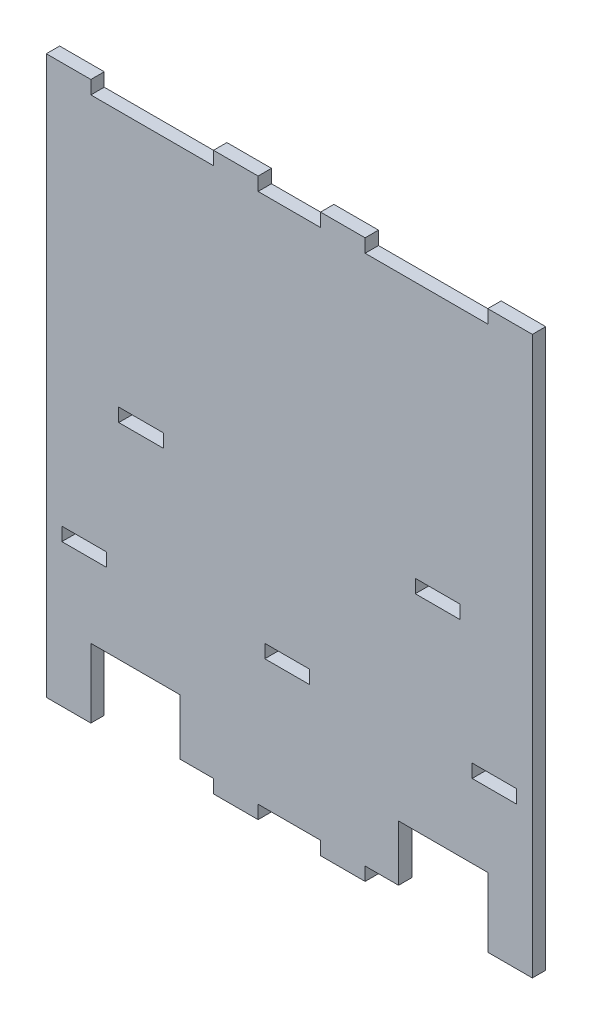
from build123d import *

# Parameters (mm, degrees)
ESQUISSE1_W             = 218
ESQUISSE1_H             = 238
ESQUISSE1_W_2           = 20
ESQUISSE1_H_2           = 6
BOSS_EXTRU_1_DEPTH      = 6
ESQUISSE2_W             = 40
ESQUISSE2_H             = 25
ENL_V_MAT_EXTRU_1_DEPTH = 6
ESQUISSE3_W             = 20
ESQUISSE3_H             = 6
BOSS_EXTRU_3_DEPTH      = 6


with BuildPart() as part:
    # Esquisse1 → Boss.-Extru.1 (new body)
    with BuildSketch(Plane.XY):
        Rectangle(ESQUISSE1_W, ESQUISSE1_H)
        with Locations((-92, -58)):
            Rectangle(ESQUISSE1_W_2, ESQUISSE1_H_2, mode=Mode.SUBTRACT)
        with Locations((-1, -58)):
            Rectangle(ESQUISSE1_W_2, ESQUISSE1_H_2, mode=Mode.SUBTRACT)
        with Locations((92, -58)):
            Rectangle(ESQUISSE1_W_2, ESQUISSE1_H_2, mode=Mode.SUBTRACT)
        with Locations((-66.5, 1)):
            Rectangle(ESQUISSE1_W_2, ESQUISSE1_H_2, mode=Mode.SUBTRACT)
        with Locations((66.5, 1)):
            Rectangle(ESQUISSE1_W_2, ESQUISSE1_H_2, mode=Mode.SUBTRACT)
    extrude(amount=BOSS_EXTRU_1_DEPTH)

    # Esquisse2 → Enlèv. mat.-Extru.1 (cut)
    with BuildSketch(Plane.XY.offset(6)):
        with Locations((-69, -106.5)):
            Rectangle(ESQUISSE2_W, ESQUISSE2_H)
        with Locations((69, -106.5)):
            Rectangle(ESQUISSE2_W, ESQUISSE2_H)
    extrude(amount=-ENL_V_MAT_EXTRU_1_DEPTH, mode=Mode.SUBTRACT)

    # Esquisse3 → Boss.-Extru.3 (add)
    with BuildSketch(Plane.XY.offset(6)):
        with Locations((-99, -122)):
            Rectangle(ESQUISSE3_W, ESQUISSE3_H)
        with Locations((-24, -122)):
            Rectangle(ESQUISSE3_W, ESQUISSE3_H)
        with Locations((99, -122)):
            Rectangle(ESQUISSE3_W, ESQUISSE3_H)
        with Locations((24, -122)):
            Rectangle(ESQUISSE3_W, ESQUISSE3_H)
        with Locations((24, 122)):
            Rectangle(ESQUISSE3_W, ESQUISSE3_H)
        with Locations((99, 122)):
            Rectangle(ESQUISSE3_W, ESQUISSE3_H)
        with Locations((-24, 122)):
            Rectangle(ESQUISSE3_W, ESQUISSE3_H)
        with Locations((-99, 122)):
            Rectangle(ESQUISSE3_W, ESQUISSE3_H)
    extrude(amount=-BOSS_EXTRU_3_DEPTH)


solid = part.part
